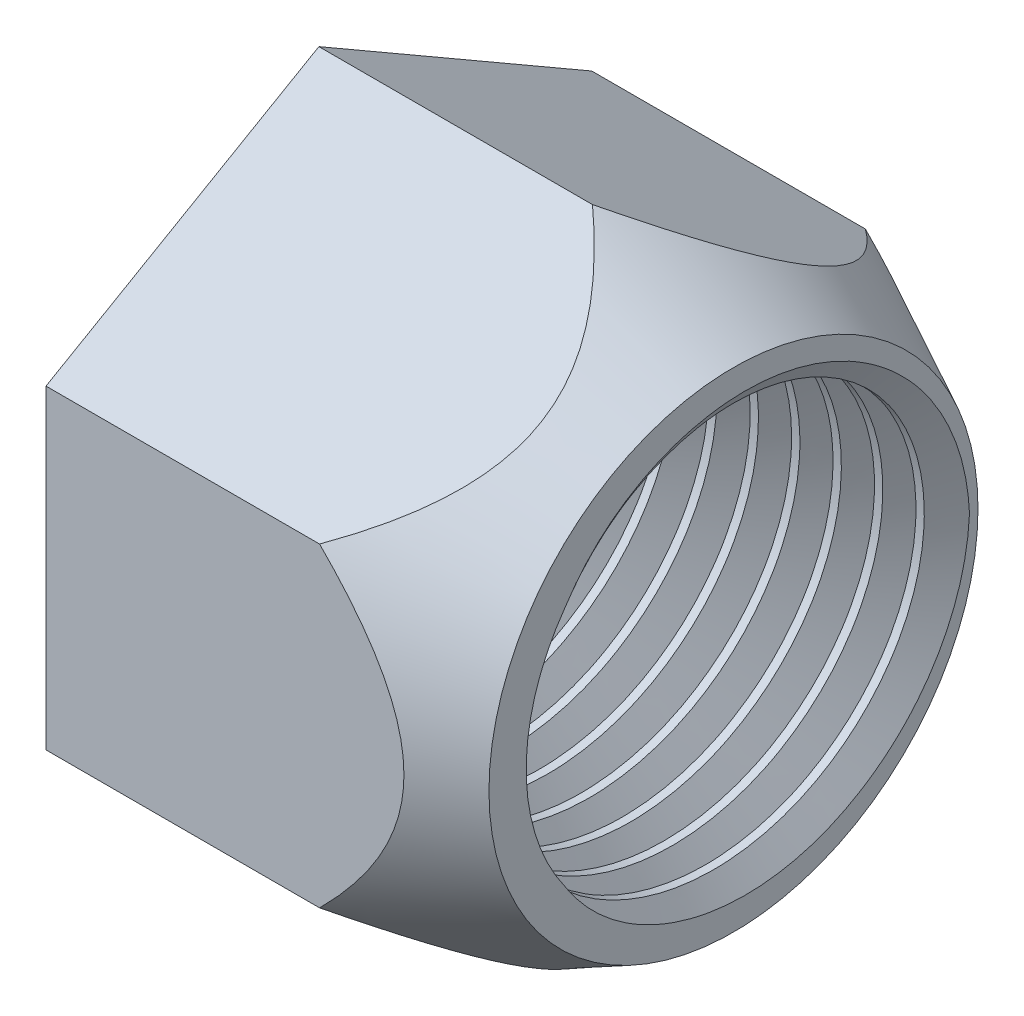
from build123d import *

# Parameters (mm, degrees)
SKETCH1_R           = 2.5
BOSS_EXTRUDE1_DEPTH = 5
CUT_SWEEP1_PITCH    = 0.5


with BuildPart() as part:
    # Sketch1 → Boss-Extrude1 (new body)
    with BuildSketch(Plane(origin=(0, 0, 0), x_dir=(0, 0, -1), z_dir=(1, 0, 0))):
        Polygon((0, 3.8), (-3.290896534, 1.9), (-3.290896534, -1.9), (0, -3.8), (3.290896534, -1.9), (3.290896534, 1.9), align=None)
        Circle(SKETCH1_R, mode=Mode.SUBTRACT)
    extrude(amount=BOSS_EXTRUDE1_DEPTH)

    # 3DSketch2 → Cut-Revolve5 (revolve, cut)
    with BuildSketch(Plane(origin=(3.299517705, 3.8, 0), x_dir=(0.9472813158672213, -0.320403040885797, 0), z_dir=(0, 0, 1)), mode=Mode.PRIVATE) as cut_revolve5_sk:
        Polygon((0, 0), (1.883524506, -0.261374788), (2.656286999, 0), (2.296280618, 1.064369793), (0.576236809, 0.482591964), (-0.087316982, 0.258155306), align=None)
    revolve(cut_revolve5_sk.sketch.rotate(Axis((0, 0, 0), (1, 0, 0)), 90), axis=Axis((0, 0, 0), (1, 0, 0)), mode=Mode.SUBTRACT)

    # Cut-Sweep1: arcs per turn and ends read off the stored shape
    # Cut-Sweep1: the profile of 3DSketch4 profile screwed along a right-hand helix through 11.666667 turns, 6 arcs to a turn; built about Z, then put on its axis
    cut_sweep1_z = Axis((0, 0, 0), (0, 0, 1))
    cut_sweep1_corners = [(2.4997, 0, -0.299826795), (2.4997, 0, -0.700173205), (2.846410162, 0, -0.5)]
    with BuildLine(mode=Mode.PRIVATE) as cut_sweep1_profile:
        Line(cut_sweep1_corners[0], cut_sweep1_corners[1])
        Line(cut_sweep1_corners[1], cut_sweep1_corners[2])
        Line(cut_sweep1_corners[2], cut_sweep1_corners[0])
    cut_sweep1_cap = Face(cut_sweep1_profile.wire())
    cut_sweep1_turn_angles = [0, 30, 60, 90, 120, 150, 180, 210, 240, 270, 300, 330, 360]
    cut_sweep1_turn_weights = [1, 0.8660254037844387, 1, 0.8660254037844387, 1, 0.8660254037844387, 1, 0.8660254037844387, 1, 0.8660254037844387, 1, 0.8660254037844387, 1]
    cut_sweep1_turn_rails = [Edge.make_bspline([Vector(p[0], p[1], 0).rotate(cut_sweep1_z, cut_sweep1_turn_angles[k]) / cut_sweep1_turn_weights[k] + Vector(0, 0, p[2] + CUT_SWEEP1_PITCH * cut_sweep1_turn_angles[k] / 360) for k in range(13)], [0, 0, 0, 1, 1, 2, 2, 3, 3, 4, 4, 5, 5, 6, 6, 6], 2, cut_sweep1_turn_weights) for p in cut_sweep1_corners]
    cut_sweep1_turn_sides = [Face.make_surface_from_curves(cut_sweep1_turn_rails[p[0]], cut_sweep1_turn_rails[p[1]]) for p in [(0, 1), (1, 2), (2, 0)]]
    cut_sweep1_last_angles = [3960, 3990, 4020, 4050, 4080, 4110, 4140, 4170, 4200]
    cut_sweep1_last_weights = [1, 0.8660254037844387, 1, 0.8660254037844387, 1, 0.8660254037844387, 1, 0.8660254037844387, 1]
    cut_sweep1_last_rails = [Edge.make_bspline([Vector(p[0], p[1], 0).rotate(cut_sweep1_z, cut_sweep1_last_angles[k]) / cut_sweep1_last_weights[k] + Vector(0, 0, p[2] + CUT_SWEEP1_PITCH * cut_sweep1_last_angles[k] / 360) for k in range(9)], [0, 0, 0, 1, 1, 2, 2, 3, 3, 4, 4, 4], 2, cut_sweep1_last_weights) for p in cut_sweep1_corners]
    cut_sweep1_last_sides = [Face.make_surface_from_curves(cut_sweep1_last_rails[p[0]], cut_sweep1_last_rails[p[1]]) for p in [(0, 1), (1, 2), (2, 0)]]
    cut_sweep1 = Plane(origin=(0, 0, 0), x_dir=(0, 0, -1), z_dir=(1, 0, 0)) * Solid(Shell([*[p.moved(Location((0, 0, CUT_SWEEP1_PITCH * i))) for i in range(11) for p in cut_sweep1_turn_sides], *cut_sweep1_last_sides, cut_sweep1_cap, cut_sweep1_cap.rotate(cut_sweep1_z, 4200).moved(Location((0, 0, CUT_SWEEP1_PITCH * 4200 / 360)))]))
    add(cut_sweep1, mode=Mode.SUBTRACT)


solid = part.part
